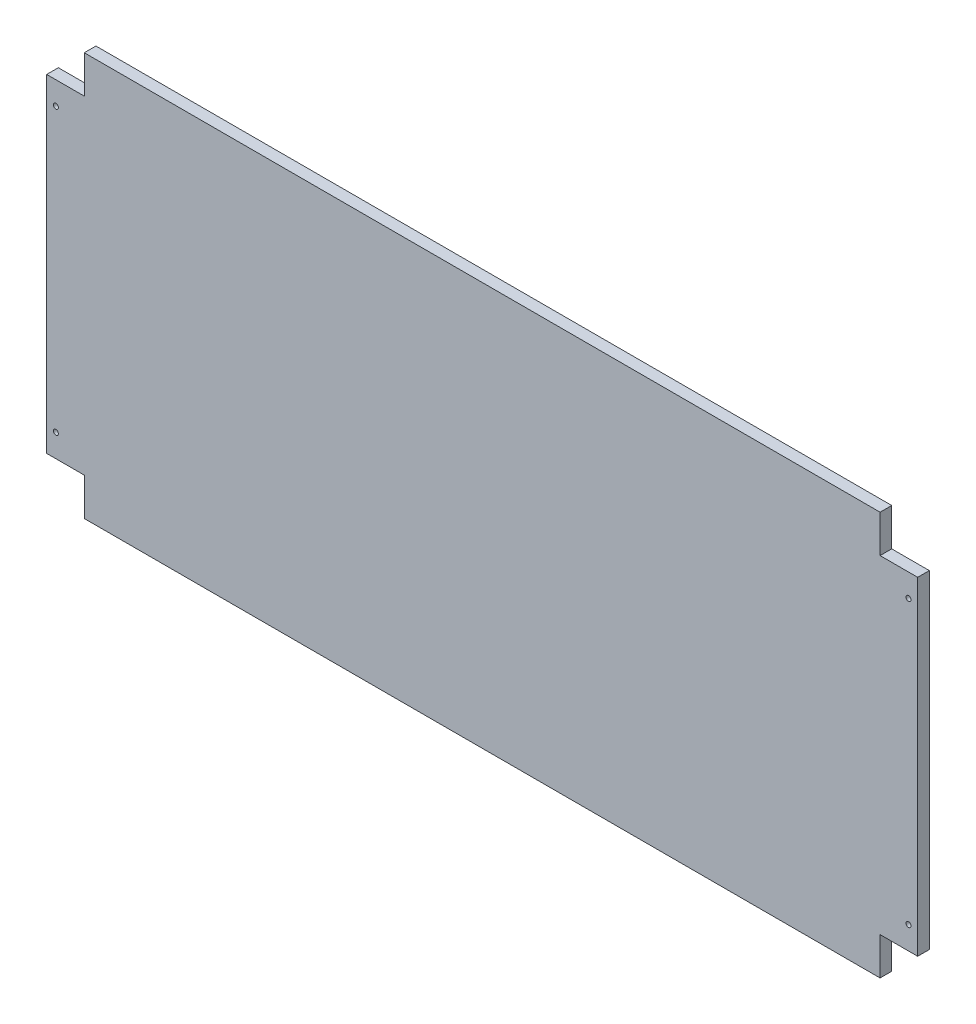
from build123d import *

# Parameters (mm, degrees)
SKETCH2_W           = 950
SKETCH2_H           = 440
BOSS_EXTRUDE1_DEPTH = 12.7
CUT_EXTRUDE1_REACH  = 525.628
SKETCH3_W           = 41
SKETCH3_H           = 41
CUT_EXTRUDE2_REACH  = 525.628
SKETCH4_R           = 2.75


with BuildPart() as part:
    # Sketch2 → Boss-Extrude1 (new body)
    with BuildSketch(Plane.XY):
        Rectangle(SKETCH2_W, SKETCH2_H)
    extrude(amount=BOSS_EXTRUDE1_DEPTH)

    # Sketch3 → Cut-Extrude1 (cut, up to next)
    with BuildSketch(Plane.XY.offset(12.7), mode=Mode.PRIVATE) as cut_extrude1_sk1:
        with Locations((-454.5, 199.5)):
            Rectangle(SKETCH3_W, SKETCH3_H)
    cut_extrude1_tool1 = extrude(cut_extrude1_sk1.sketch, amount=-CUT_EXTRUDE1_REACH, mode=Mode.PRIVATE) & part.part
    # Sketch3 → Cut-Extrude1 (cut, up to next)
    with BuildSketch(Plane.XY.offset(12.7), mode=Mode.PRIVATE) as cut_extrude1_sk2:
        with Locations((454.5, 199.5)):
            Rectangle(SKETCH3_W, SKETCH3_H)
    cut_extrude1_tool2 = extrude(cut_extrude1_sk2.sketch, amount=-CUT_EXTRUDE1_REACH, mode=Mode.PRIVATE) & part.part
    # Sketch3 → Cut-Extrude1 (cut, up to next)
    with BuildSketch(Plane.XY.offset(12.7), mode=Mode.PRIVATE) as cut_extrude1_sk3:
        with Locations((454.5, -199.5)):
            Rectangle(SKETCH3_W, SKETCH3_H)
    cut_extrude1_tool3 = extrude(cut_extrude1_sk3.sketch, amount=-CUT_EXTRUDE1_REACH, mode=Mode.PRIVATE) & part.part
    # Sketch3 → Cut-Extrude1 (cut, up to next)
    with BuildSketch(Plane.XY.offset(12.7), mode=Mode.PRIVATE) as cut_extrude1_sk4:
        with Locations((-454.5, -199.5)):
            Rectangle(SKETCH3_W, SKETCH3_H)
    cut_extrude1_tool4 = extrude(cut_extrude1_sk4.sketch, amount=-CUT_EXTRUDE1_REACH, mode=Mode.PRIVATE) & part.part
    add(cut_extrude1_tool1.solids().sort_by_distance((-454.5, 199.5, 12.7))[0], mode=Mode.SUBTRACT)
    add(cut_extrude1_tool2.solids().sort_by_distance((454.5, 199.5, 12.7))[0], mode=Mode.SUBTRACT)
    add(cut_extrude1_tool3.solids().sort_by_distance((454.5, -199.5, 12.7))[0], mode=Mode.SUBTRACT)
    add(cut_extrude1_tool4.solids().sort_by_distance((-454.5, -199.5, 12.7))[0], mode=Mode.SUBTRACT)

    # Sketch4 → Cut-Extrude2 (cut, up to next)
    with BuildSketch(Plane.XY.offset(12.7), mode=Mode.PRIVATE) as cut_extrude2_sk1:
        with Locations((-465, -154)):
            Circle(SKETCH4_R)
    cut_extrude2_tool1 = extrude(cut_extrude2_sk1.sketch, amount=-CUT_EXTRUDE2_REACH, mode=Mode.PRIVATE) & part.part
    # Sketch4 → Cut-Extrude2 (cut, up to next)
    with BuildSketch(Plane.XY.offset(12.7), mode=Mode.PRIVATE) as cut_extrude2_sk2:
        with Locations((-465, 154)):
            Circle(SKETCH4_R)
    cut_extrude2_tool2 = extrude(cut_extrude2_sk2.sketch, amount=-CUT_EXTRUDE2_REACH, mode=Mode.PRIVATE) & part.part
    # Sketch4 → Cut-Extrude2 (cut, up to next)
    with BuildSketch(Plane.XY.offset(12.7), mode=Mode.PRIVATE) as cut_extrude2_sk3:
        with Locations((465, -154)):
            Circle(SKETCH4_R)
    cut_extrude2_tool3 = extrude(cut_extrude2_sk3.sketch, amount=-CUT_EXTRUDE2_REACH, mode=Mode.PRIVATE) & part.part
    # Sketch4 → Cut-Extrude2 (cut, up to next)
    with BuildSketch(Plane.XY.offset(12.7), mode=Mode.PRIVATE) as cut_extrude2_sk4:
        with Locations((465, 154)):
            Circle(SKETCH4_R)
    cut_extrude2_tool4 = extrude(cut_extrude2_sk4.sketch, amount=-CUT_EXTRUDE2_REACH, mode=Mode.PRIVATE) & part.part
    add(cut_extrude2_tool1.solids().sort_by_distance((-465, -154, 12.7))[0], mode=Mode.SUBTRACT)
    add(cut_extrude2_tool2.solids().sort_by_distance((-465, 154, 12.7))[0], mode=Mode.SUBTRACT)
    add(cut_extrude2_tool3.solids().sort_by_distance((465, -154, 12.7))[0], mode=Mode.SUBTRACT)
    add(cut_extrude2_tool4.solids().sort_by_distance((465, 154, 12.7))[0], mode=Mode.SUBTRACT)


solid = part.part
